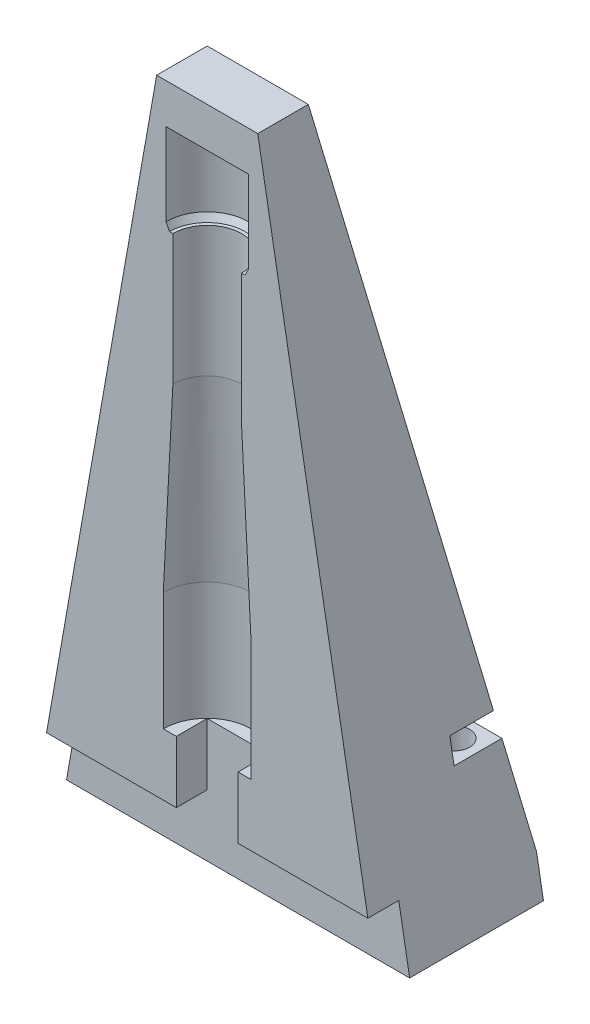
from build123d import *

# Parameters (mm, degrees)
SKETCH_2_W               = 50
SKETCH_2_H               = 50
EXTRUDE_1_DEPTH          = 100
EXTRUDE_1_TAPER          = 10
SKETCH_3_W               = 215.720321278
SKETCH_3_H               = 290.879799434
CUT_EXTRUDE_1_DEPTH      = 107.066017319
SKETCH_7_W               = 4.5
SKETCH_7_H               = 23.792731937
SKETCH_8_W               = 50
SKETCH_8_H               = 4.5
CUT_EXTRUDE_2_DEPTH      = 9
SKETCH_9_W               = 9
SKETCH_9_H               = 9
CUT_EXTRUDE_3_DEPTH      = 4.5
SKETCH_10_W              = 7
SKETCH_10_H              = 3.5
CUT_EXTRUDE_4_DEPTH      = 10.5
SKETCH_11_R              = 2.25
CUT_EXTRUDE_5_DEPTH      = 20
CUT_EXTRUDE_6_DEPTH      = 107.066017319
CUT_EXTRUDE_6_DEPTH_BACK = 107.066017319
SKETCH_12_W              = 75.055418853
SKETCH_12_H              = 23.361905794


with BuildPart() as part:
    # 草圖2 → 填料-伸長1 (new body)
    with BuildSketch(Plane(origin=(0, 0, 0), x_dir=(1, 0, 0), z_dir=(0, 1, 0))):
        Rectangle(SKETCH_2_W, SKETCH_2_H)
    extrude(amount=EXTRUDE_1_DEPTH, taper=EXTRUDE_1_TAPER)

    # 草圖3 → 除料-伸長1 (cut, through all)
    with BuildSketch(Plane.XY):
        Rectangle(SKETCH_3_W, SKETCH_3_H)
    extrude(amount=CUT_EXTRUDE_1_DEPTH, mode=Mode.SUBTRACT)


with BuildPart() as body_2:
    # stick_antenna_434MHz: read off the stored shape, not the designer's step
    # stick_antenna_434MHz outline → stick_antenna_434MHz (revolve)
    with BuildSketch(Plane.XY):
        Polygon((0, 94.2), (0, 23), (3, 23), (3, 18), (6.4, 18), (6.4, 35.2), (5, 62.2), (5, 81.2), (5.5, 81.2), (6, 82.2), (6, 94.2), align=None)
    revolve(axis=Axis((0, 0, 0), (0, 1, 0)))


with BuildPart() as part_1:
    add(part.part)

    # Other 1: read off the stored shape, not the designer's step
    # Other 1: cut body 2
    add(body_2.part, mode=Mode.SUBTRACT)

    # 草圖7 → 除料-旋轉1 (revolve, cut)
    with BuildSketch(Plane.XY):
        with Locations((2.25, 11.896365969)):
            Rectangle(SKETCH_7_W, SKETCH_7_H)
    revolve(axis=Axis((0, 30.263839144, 0), (0, -1, 0)), mode=Mode.SUBTRACT)

    # 草圖8 → 除料-伸長2 (cut)
    with BuildSketch(Plane.XZ):
        with Locations((0, -2.25)):
            Rectangle(SKETCH_8_W, SKETCH_8_H)
    extrude(amount=-CUT_EXTRUDE_2_DEPTH, mode=Mode.SUBTRACT)

    # 草圖9 → 除料-伸長3 (cut)
    with BuildSketch(Plane.XY):
        with Locations((0, 13.5)):
            Rectangle(SKETCH_9_W, SKETCH_9_H)
    extrude(amount=-CUT_EXTRUDE_3_DEPTH, mode=Mode.SUBTRACT)

    # 草圖10 → 除料-伸長4 (cut)
    with BuildSketch(Plane.XY.offset(-25)):
        with Locations((-18, 21.75)):
            Rectangle(SKETCH_10_W, SKETCH_10_H)
    cut_extrude_4 = extrude(amount=CUT_EXTRUDE_4_DEPTH, mode=Mode.SUBTRACT)

    # 草圖11 → 除料-伸長5 (cut)
    with BuildSketch(Plane.XZ):
        with Locations(Location((-18, -18, 0), (0, 0, 270))):
            Circle(SKETCH_11_R)
        with Locations(Location((18, -18, 0), (0, 0, 90))):
            Circle(SKETCH_11_R)
    extrude(amount=-CUT_EXTRUDE_5_DEPTH, mode=Mode.SUBTRACT)

    # 鏡射2: 除料-伸長4 across plane
    add(cut_extrude_4.mirror(Plane(origin=(0, 0, 0), x_dir=(0, 0, 1), z_dir=(1, 0, 0))), mode=Mode.SUBTRACT)

    # 草圖12 → 除料-伸長6 (cut, two sides: drawn at the far end of the back side and taken through both)
    with BuildSketch(Plane(origin=(0, 0, 0), x_dir=(0, 0, -1), z_dir=(1, 0, 0)).offset(-CUT_EXTRUDE_6_DEPTH_BACK)):
        with Locations((61.527709427, 0)):
            Rectangle(SKETCH_12_W, SKETCH_12_H)
    extrude(amount=CUT_EXTRUDE_6_DEPTH + CUT_EXTRUDE_6_DEPTH_BACK, mode=Mode.SUBTRACT)


solid = part_1.part
